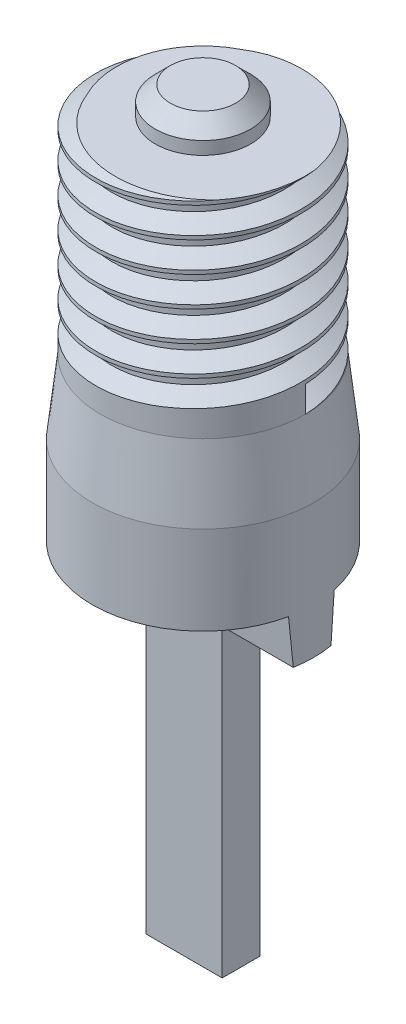
from build123d import *

# Parameters (mm, degrees)
CUT_EXTRUDE1_DEPTH       = 12
CUT_EXTRUDE1_DEPTH_BACK  = 12
BOSS_EXTRUDE1_DEPTH      = 1.27
BOSS_EXTRUDE1_DEPTH_BACK = 1.27
SKETCH3_W                = 1.257334554
SKETCH3_H                = 10.16
CUT_EXTRUDE2_REACH       = 23.562
SKETCH4_R                = 5.3467
CHAMFER1_SIZE            = 0.5
THREAD1_PITCH            = 1


with BuildPart() as part:
    # Sketch1 → Revolve1 (revolve)
    with BuildSketch(Plane(origin=(0, 0, 0), x_dir=(0, 0, -1), z_dir=(1, 0, 0)), mode=Mode.PRIVATE) as revolve1_sk:
        with BuildLine():
            Line((5.3467, 29.6164), (5.3467, 25.787746778))
            Line((5.3467, 25.787746778), (4.839751483, 25.315967815))
            Line((4.839751483, 25.315967815), (3.898985355, 10.6934))
            Line((3.898985355, 10.6934), (3.6957, 10.6934))
            Line((3.6957, 10.6934), (3.6957, 6.2738))
            Line((3.6957, 6.2738), (0, 6.2738))
            Line((0, 6.2738), (0, 30.8864))
            ThreePointArc((0, 30.8864), (2.747730923, 30.564543684), (5.3467, 29.6164))
        make_face()
    revolve(revolve1_sk.sketch.rotate(Axis((0, 6.2738, 0), (0, 1, 0)), 180), axis=Axis((0, 6.2738, 0), (0, 1, 0)))

    # Sketch2 → Cut-Extrude1 (cut, two sides: drawn at the far end of the back side and taken through both)
    with BuildSketch(Plane(origin=(0, 0, 0), x_dir=(0, 0, -1), z_dir=(1, 0, 0)).offset(-CUT_EXTRUDE1_DEPTH_BACK)):
        Polygon((-3.6957, 5.1562), (3.6957, 5.1562), (3.6957, 8.2042), (0.762, 8.2042), (0.628667277, 6.6802), (-0.628667277, 6.6802), (-0.762, 8.2042), (-3.6957, 8.2042), align=None)
    extrude(amount=CUT_EXTRUDE1_DEPTH + CUT_EXTRUDE1_DEPTH_BACK, mode=Mode.SUBTRACT)

    # Sketch3 → Boss-Extrude1 (add, two sides: drawn at the far end of the back side and taken through both)
    with BuildSketch(Plane(origin=(0, 0, 0), x_dir=(0, 0, -1), z_dir=(1, 0, 0)).offset(-BOSS_EXTRUDE1_DEPTH_BACK)):
        with Locations((0, 1.6002)):
            Rectangle(SKETCH3_W, SKETCH3_H)
    extrude(amount=BOSS_EXTRUDE1_DEPTH + BOSS_EXTRUDE1_DEPTH_BACK)

    # Sketch4 → Cut-Extrude2 (cut, up to next)
    with BuildSketch(Plane.XZ.offset(-10.6934), mode=Mode.PRIVATE) as cut_extrude2_sk1:
        Circle(SKETCH4_R)
    cut_extrude2_tool1 = extrude(cut_extrude2_sk1.sketch, amount=-CUT_EXTRUDE2_REACH, mode=Mode.PRIVATE) & part.part
    add(cut_extrude2_tool1.solids().sort_by_distance((0, 10.6934, 0))[0], mode=Mode.SUBTRACT)

    # Sketch5 → Revolve2 (revolve)
    with BuildSketch(Plane(origin=(0, 0, 0), x_dir=(0, 0, -1), z_dir=(1, 0, 0))):
        Polygon((0, 21.3942), (1.59, 21.3942), (1.59, 20.4642), (3.425, 20.4642), (3.425, 13.5742), (3.6957, 11.1542), (3.6957, 8.2042), (0, 8.2042), align=None)
    revolve(axis=Axis((0, 8.2042, 0), (0, 1, 0)))

    # Chamfer1
    chamfer1_edges = [part.edges().sort_by_distance(p)[0] for p in [
        (0, 21.3942, 1.59),
    ]]
    chamfer(chamfer1_edges, length=CHAMFER1_SIZE)

    # Thread1: the profile of Thread Profile2 profile screwed along a right-hand helix of 7.82 turns, 8 arcs to a turn; built about Z, then put on its axis
    thread1_z = Axis((0, 0, 0), (0, 0, 1))
    thread1_corners = [(3.4253, 0, -0.000173205), (3.4253, 0, 0.875173202), (2.883734125, 0, 0.562499999), (2.883734125, 0, 0.312499999)]
    with BuildLine(mode=Mode.PRIVATE) as thread1_profile:
        Line(thread1_corners[0], thread1_corners[1])
        Line(thread1_corners[1], thread1_corners[2])
        Line(thread1_corners[2], thread1_corners[3])
        Line(thread1_corners[3], thread1_corners[0])
    thread1_cap = Face(thread1_profile.wire())
    thread1_turn_angles = [0, 22.5, 45, 67.5, 90, 112.5, 135, 157.5, 180, 202.5, 225, 247.5, 270, 292.5, 315, 337.5, 360]
    thread1_turn_weights = [1, 0.9238795325112867, 1, 0.9238795325112867, 1, 0.9238795325112867, 1, 0.9238795325112867, 1, 0.9238795325112867, 1, 0.9238795325112867, 1, 0.9238795325112867, 1, 0.9238795325112867, 1]
    thread1_turn_rails = [Edge.make_bspline([Vector(p[0], p[1], 0).rotate(thread1_z, thread1_turn_angles[k]) / thread1_turn_weights[k] + Vector(0, 0, p[2] + THREAD1_PITCH * thread1_turn_angles[k] / 360) for k in range(17)], [0, 0, 0, 1, 1, 2, 2, 3, 3, 4, 4, 5, 5, 6, 6, 7, 7, 8, 8, 8], 2, thread1_turn_weights) for p in thread1_corners]
    thread1_turn_sides = [Face.make_surface_from_curves(thread1_turn_rails[p[0]], thread1_turn_rails[p[1]]) for p in [(0, 1), (1, 2), (2, 3), (3, 0)]]
    thread1_last_angles = [2520, 2542.5, 2565, 2587.5, 2610, 2632.5, 2655, 2677.5, 2700, 2722.5, 2745, 2767.5, 2790, 2802.6, 2815.2]
    thread1_last_weights = [1, 0.9238795325112867, 1, 0.9238795325112867, 1, 0.9238795325112867, 1, 0.9238795325112867, 1, 0.9238795325112867, 1, 0.9238795325112867, 1, 0.9759167619387469, 1]
    thread1_last_rails = [Edge.make_bspline([Vector(p[0], p[1], 0).rotate(thread1_z, thread1_last_angles[k]) / thread1_last_weights[k] + Vector(0, 0, p[2] + THREAD1_PITCH * thread1_last_angles[k] / 360) for k in range(15)], [0, 0, 0, 1, 1, 2, 2, 3, 3, 4, 4, 5, 5, 6, 6, 7, 7, 7], 2, thread1_last_weights) for p in thread1_corners]
    thread1_last_sides = [Face.make_surface_from_curves(thread1_last_rails[p[0]], thread1_last_rails[p[1]]) for p in [(0, 1), (1, 2), (2, 3), (3, 0)]]
    thread1 = Plane(origin=(0, 13.5742, 0), x_dir=(1, 0, 0), z_dir=(0, 1, 0)) * Solid(Shell([*[p.moved(Location((0, 0, THREAD1_PITCH * i))) for i in range(7) for p in thread1_turn_sides], *thread1_last_sides, thread1_cap, thread1_cap.rotate(thread1_z, 2815.2).moved(Location((0, 0, THREAD1_PITCH * 2815.2 / 360)))]))
    add(thread1, mode=Mode.SUBTRACT)


solid = part.part
